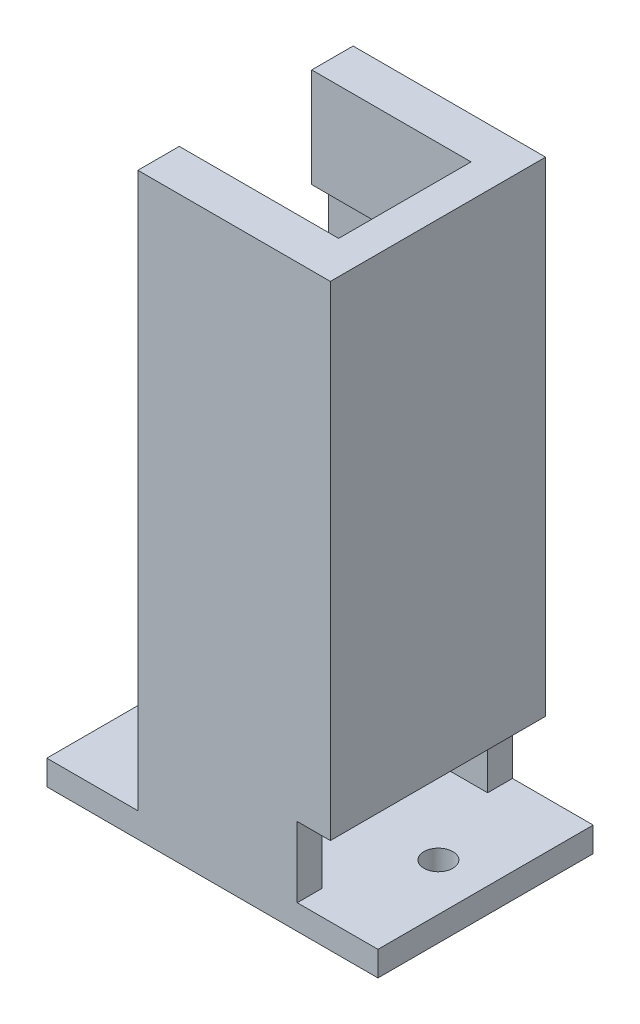
from build123d import *

# Parameters (mm, degrees)
SKETCH1_W           = 40
SKETCH1_H           = 26
BOSS_EXTRUDE1_DEPTH = 3
SKETCH2_R           = 1.75
CUT_EXTRUDE1_DEPTH  = 3
SKETCH3_W           = 19.25
SKETCH3_H           = 3
BOSS_EXTRUDE2_DEPTH = 55
SKETCH5_W           = 19.25
SKETCH5_H           = 5
BOSS_EXTRUDE4_DEPTH = 12
SKETCH6_R           = 2.5
CUT_EXTRUDE2_DEPTH  = 15
SKETCH7_W           = 26
SKETCH7_H           = 58.5
BOSS_EXTRUDE5_DEPTH = 4


with BuildPart() as part:
    # Sketch1 → Boss-Extrude1 (new body)
    with BuildSketch(Plane(origin=(0, 0, 0), x_dir=(1, 0, 0), z_dir=(0, 1, 0))):
        Rectangle(SKETCH1_W, SKETCH1_H)
    extrude(amount=BOSS_EXTRUDE1_DEPTH)

    # Sketch2 → Cut-Extrude1 (cut)
    with BuildSketch(Plane(origin=(0, 3, 0), x_dir=(1, 0, 0), z_dir=(0, 1, 0))):
        with Locations((14.3, 0)):
            Circle(SKETCH2_R)
        with Locations((-14.3, 0)):
            Circle(SKETCH2_R)
    extrude(amount=-CUT_EXTRUDE1_DEPTH, mode=Mode.SUBTRACT)

    # Sketch3 → Boss-Extrude2 (add)
    with BuildSketch(Plane(origin=(0, 3, 0), x_dir=(1, 0, 0), z_dir=(0, 1, 0))):
        with Locations((0.625, -11.5)):
            Rectangle(SKETCH3_W, SKETCH3_H)
        with Locations((0.625, 11.5)):
            Rectangle(SKETCH3_W, SKETCH3_H)
    extrude(amount=BOSS_EXTRUDE2_DEPTH)

    # Sketch5 → Boss-Extrude4 (add)
    with BuildSketch(Plane(origin=(0, 58, 0), x_dir=(1, 0, 0), z_dir=(0, 1, 0))):
        with Locations((0.625, 10.5)):
            Rectangle(SKETCH5_W, SKETCH5_H)
        with Locations((0.625, -10.5)):
            Rectangle(SKETCH5_W, SKETCH5_H)
    extrude(amount=BOSS_EXTRUDE4_DEPTH)

    # Sketch6 → Cut-Extrude2 (cut)
    with BuildSketch(Plane(origin=(0, 3, 0), x_dir=(1, 0, 0), z_dir=(0, 1, 0))):
        Circle(SKETCH6_R)
    extrude(amount=-CUT_EXTRUDE2_DEPTH, mode=Mode.SUBTRACT)

    # Sketch7 → Boss-Extrude5 (add)
    with BuildSketch(Plane(origin=(10.25, 0, 0), x_dir=(0, 0, -1), z_dir=(1, 0, 0))):
        with Locations((0, 40.75)):
            Rectangle(SKETCH7_W, SKETCH7_H)
    extrude(amount=BOSS_EXTRUDE5_DEPTH)


solid = part.part
